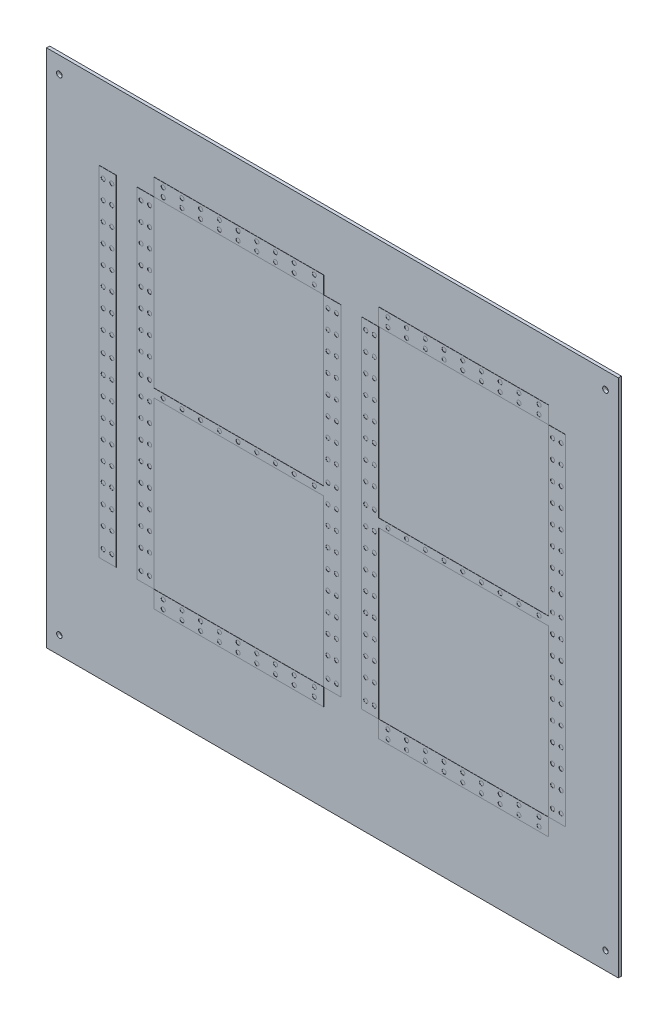
from build123d import *

# Parameters (mm, degrees)
ESBO_O4_W                      = 550
ESBO_O4_H                      = 500
FLANGE_BASE1_DEPTH             = 3
RESSALTO_EXTRUS_O1_OUTLINE_W   = 163.357552271
RESSALTO_EXTRUS_O1_OUTLINE_H   = 16.4
RESSALTO_EXTRUS_O1_OUTLINE_R   = 2
RESSALTO_EXTRUS_O1_OUTLINE_W_2 = 163.357552272
RESSALTO_EXTRUS_O1_OUTLINE_W_3 = 16.4
RESSALTO_EXTRUS_O1_OUTLINE_H_2 = 326.715104542
RESSALTO_EXTRUS_O1_DEPTH       = 0.2
ESBO_O5_R                      = 2.714887618
ESBO_O5_R_2                    = 2.6
CORTE_EXTRUS_O1_DEPTH          = 10


# Read off the part's stored shape, not the designer's step: Ressalto-extrusão1
# Sheet-metal steps are written as plain solids
with BuildPart() as part:
    # Esboço4 → Flange-base1 (new body)
    with BuildSketch(Plane.XY):
        Rectangle(ESBO_O4_W, ESBO_O4_H)
    extrude(amount=-FLANGE_BASE1_DEPTH)

    # Ressalto-extrusão1 outline → Ressalto-extrusão1 (add)
    # profile 1 of 7: a face of its own
    with BuildSketch(Plane.XY):
        with Locations((126.278776136, -157.578108444)):
            Rectangle(RESSALTO_EXTRUS_O1_OUTLINE_W, RESSALTO_EXTRUS_O1_OUTLINE_H)
        with Locations((53.6, -161.678108444)):
            Circle(RESSALTO_EXTRUS_O1_OUTLINE_R, mode=Mode.SUBTRACT)
        with Locations((53.6, -153.478108444)):
            Circle(RESSALTO_EXTRUS_O1_OUTLINE_R, mode=Mode.SUBTRACT)
        with Locations((71.6, -161.678108444)):
            Circle(RESSALTO_EXTRUS_O1_OUTLINE_R, mode=Mode.SUBTRACT)
        with Locations((71.6, -153.478108444)):
            Circle(RESSALTO_EXTRUS_O1_OUTLINE_R, mode=Mode.SUBTRACT)
        with Locations((89.6, -161.678108444)):
            Circle(RESSALTO_EXTRUS_O1_OUTLINE_R, mode=Mode.SUBTRACT)
        with Locations((107.6, -161.678108444)):
            Circle(RESSALTO_EXTRUS_O1_OUTLINE_R, mode=Mode.SUBTRACT)
        with Locations((89.6, -153.478108444)):
            Circle(RESSALTO_EXTRUS_O1_OUTLINE_R, mode=Mode.SUBTRACT)
        with Locations((107.6, -153.478108444)):
            Circle(RESSALTO_EXTRUS_O1_OUTLINE_R, mode=Mode.SUBTRACT)
        with Locations((125.6, -161.678108444)):
            Circle(RESSALTO_EXTRUS_O1_OUTLINE_R, mode=Mode.SUBTRACT)
        with Locations((125.6, -153.478108444)):
            Circle(RESSALTO_EXTRUS_O1_OUTLINE_R, mode=Mode.SUBTRACT)
        with Locations((143.6, -161.678108444)):
            Circle(RESSALTO_EXTRUS_O1_OUTLINE_R, mode=Mode.SUBTRACT)
        with Locations((161.6, -161.678108444)):
            Circle(RESSALTO_EXTRUS_O1_OUTLINE_R, mode=Mode.SUBTRACT)
        with Locations((143.6, -153.478108444)):
            Circle(RESSALTO_EXTRUS_O1_OUTLINE_R, mode=Mode.SUBTRACT)
        with Locations((161.6, -153.478108444)):
            Circle(RESSALTO_EXTRUS_O1_OUTLINE_R, mode=Mode.SUBTRACT)
        with Locations((179.6, -161.678108444)):
            Circle(RESSALTO_EXTRUS_O1_OUTLINE_R, mode=Mode.SUBTRACT)
        with Locations((179.6, -153.478108444)):
            Circle(RESSALTO_EXTRUS_O1_OUTLINE_R, mode=Mode.SUBTRACT)
        with Locations((198.957552271, -161.678108444)):
            Circle(RESSALTO_EXTRUS_O1_OUTLINE_R, mode=Mode.SUBTRACT)
        with Locations((198.957552271, -153.478108444)):
            Circle(RESSALTO_EXTRUS_O1_OUTLINE_R, mode=Mode.SUBTRACT)
    # profile 2 of 7: a face of its own
    with BuildSketch(Plane.XY):
        Polygon((207.957552271, 18.2), (44.6, 18.2), (44.6, 177.457552271), (28.2, 177.457552271), (28.2, -149.257552271), (44.6, -149.257552271), (44.6, 10), (207.957552271, 10), (207.957552271, -149.257552271), (224.357552271, -149.257552271), (224.357552271, 177.457552271), (207.957552271, 177.457552271), align=None)
        with Locations((32.3, -140.257552271)):
            Circle(RESSALTO_EXTRUS_O1_OUTLINE_R, mode=Mode.SUBTRACT)
        with Locations((40.5, -140.257552271)):
            Circle(RESSALTO_EXTRUS_O1_OUTLINE_R, mode=Mode.SUBTRACT)
        with Locations((32.3, -120.9)):
            Circle(RESSALTO_EXTRUS_O1_OUTLINE_R, mode=Mode.SUBTRACT)
        with Locations((40.5, -120.9)):
            Circle(RESSALTO_EXTRUS_O1_OUTLINE_R, mode=Mode.SUBTRACT)
        with Locations((32.3, -102.9)):
            Circle(RESSALTO_EXTRUS_O1_OUTLINE_R, mode=Mode.SUBTRACT)
        with Locations((40.5, -102.9)):
            Circle(RESSALTO_EXTRUS_O1_OUTLINE_R, mode=Mode.SUBTRACT)
        with Locations((32.3, -84.9)):
            Circle(RESSALTO_EXTRUS_O1_OUTLINE_R, mode=Mode.SUBTRACT)
        with Locations((40.5, -84.9)):
            Circle(RESSALTO_EXTRUS_O1_OUTLINE_R, mode=Mode.SUBTRACT)
        with Locations((212.057552271, -140.257552271)):
            Circle(RESSALTO_EXTRUS_O1_OUTLINE_R, mode=Mode.SUBTRACT)
        with Locations((220.257552271, -140.257552271)):
            Circle(RESSALTO_EXTRUS_O1_OUTLINE_R, mode=Mode.SUBTRACT)
        with Locations((212.057552271, -120.9)):
            Circle(RESSALTO_EXTRUS_O1_OUTLINE_R, mode=Mode.SUBTRACT)
        with Locations((220.257552271, -120.9)):
            Circle(RESSALTO_EXTRUS_O1_OUTLINE_R, mode=Mode.SUBTRACT)
        with Locations((212.057552271, -102.9)):
            Circle(RESSALTO_EXTRUS_O1_OUTLINE_R, mode=Mode.SUBTRACT)
        with Locations((220.257552271, -102.9)):
            Circle(RESSALTO_EXTRUS_O1_OUTLINE_R, mode=Mode.SUBTRACT)
        with Locations((212.057552271, -84.9)):
            Circle(RESSALTO_EXTRUS_O1_OUTLINE_R, mode=Mode.SUBTRACT)
        with Locations((220.257552271, -84.9)):
            Circle(RESSALTO_EXTRUS_O1_OUTLINE_R, mode=Mode.SUBTRACT)
        with Locations((32.3, -66.9)):
            Circle(RESSALTO_EXTRUS_O1_OUTLINE_R, mode=Mode.SUBTRACT)
        with Locations((40.5, -66.9)):
            Circle(RESSALTO_EXTRUS_O1_OUTLINE_R, mode=Mode.SUBTRACT)
        with Locations((32.3, -48.9)):
            Circle(RESSALTO_EXTRUS_O1_OUTLINE_R, mode=Mode.SUBTRACT)
        with Locations((40.5, -48.9)):
            Circle(RESSALTO_EXTRUS_O1_OUTLINE_R, mode=Mode.SUBTRACT)
        with Locations((32.3, -30.9)):
            Circle(RESSALTO_EXTRUS_O1_OUTLINE_R, mode=Mode.SUBTRACT)
        with Locations((40.5, -30.9)):
            Circle(RESSALTO_EXTRUS_O1_OUTLINE_R, mode=Mode.SUBTRACT)
        with Locations((32.3, -12.9)):
            Circle(RESSALTO_EXTRUS_O1_OUTLINE_R, mode=Mode.SUBTRACT)
        with Locations((40.5, -12.9)):
            Circle(RESSALTO_EXTRUS_O1_OUTLINE_R, mode=Mode.SUBTRACT)
        with Locations((32.3, 5.1)):
            Circle(RESSALTO_EXTRUS_O1_OUTLINE_R, mode=Mode.SUBTRACT)
        with Locations((40.5, 5.1)):
            Circle(RESSALTO_EXTRUS_O1_OUTLINE_R, mode=Mode.SUBTRACT)
        with Locations((53.6, 14.1)):
            Circle(RESSALTO_EXTRUS_O1_OUTLINE_R, mode=Mode.SUBTRACT)
        with Locations((71.6, 14.1)):
            Circle(RESSALTO_EXTRUS_O1_OUTLINE_R, mode=Mode.SUBTRACT)
        with Locations((89.6, 14.1)):
            Circle(RESSALTO_EXTRUS_O1_OUTLINE_R, mode=Mode.SUBTRACT)
        with Locations((107.6, 14.1)):
            Circle(RESSALTO_EXTRUS_O1_OUTLINE_R, mode=Mode.SUBTRACT)
        with Locations((212.057552271, -66.9)):
            Circle(RESSALTO_EXTRUS_O1_OUTLINE_R, mode=Mode.SUBTRACT)
        with Locations((220.257552271, -66.9)):
            Circle(RESSALTO_EXTRUS_O1_OUTLINE_R, mode=Mode.SUBTRACT)
        with Locations((212.057552271, -48.9)):
            Circle(RESSALTO_EXTRUS_O1_OUTLINE_R, mode=Mode.SUBTRACT)
        with Locations((220.257552271, -48.9)):
            Circle(RESSALTO_EXTRUS_O1_OUTLINE_R, mode=Mode.SUBTRACT)
        with Locations((212.057552271, -30.9)):
            Circle(RESSALTO_EXTRUS_O1_OUTLINE_R, mode=Mode.SUBTRACT)
        with Locations((220.257552271, -30.9)):
            Circle(RESSALTO_EXTRUS_O1_OUTLINE_R, mode=Mode.SUBTRACT)
        with Locations((125.6, 14.1)):
            Circle(RESSALTO_EXTRUS_O1_OUTLINE_R, mode=Mode.SUBTRACT)
        with Locations((143.6, 14.1)):
            Circle(RESSALTO_EXTRUS_O1_OUTLINE_R, mode=Mode.SUBTRACT)
        with Locations((161.6, 14.1)):
            Circle(RESSALTO_EXTRUS_O1_OUTLINE_R, mode=Mode.SUBTRACT)
        with Locations((212.057552271, -12.9)):
            Circle(RESSALTO_EXTRUS_O1_OUTLINE_R, mode=Mode.SUBTRACT)
        with Locations((220.257552271, -12.9)):
            Circle(RESSALTO_EXTRUS_O1_OUTLINE_R, mode=Mode.SUBTRACT)
        with Locations((179.6, 14.1)):
            Circle(RESSALTO_EXTRUS_O1_OUTLINE_R, mode=Mode.SUBTRACT)
        with Locations((198.957552271, 14.1)):
            Circle(RESSALTO_EXTRUS_O1_OUTLINE_R, mode=Mode.SUBTRACT)
        with Locations((212.057552271, 5.1)):
            Circle(RESSALTO_EXTRUS_O1_OUTLINE_R, mode=Mode.SUBTRACT)
        with Locations((220.257552271, 5.1)):
            Circle(RESSALTO_EXTRUS_O1_OUTLINE_R, mode=Mode.SUBTRACT)
        with Locations((32.3, 23.1)):
            Circle(RESSALTO_EXTRUS_O1_OUTLINE_R, mode=Mode.SUBTRACT)
        with Locations((40.5, 23.1)):
            Circle(RESSALTO_EXTRUS_O1_OUTLINE_R, mode=Mode.SUBTRACT)
        with Locations((32.3, 42.457552271)):
            Circle(RESSALTO_EXTRUS_O1_OUTLINE_R, mode=Mode.SUBTRACT)
        with Locations((40.5, 42.457552271)):
            Circle(RESSALTO_EXTRUS_O1_OUTLINE_R, mode=Mode.SUBTRACT)
        with Locations((32.3, 60.457552271)):
            Circle(RESSALTO_EXTRUS_O1_OUTLINE_R, mode=Mode.SUBTRACT)
        with Locations((40.5, 60.457552271)):
            Circle(RESSALTO_EXTRUS_O1_OUTLINE_R, mode=Mode.SUBTRACT)
        with Locations((32.3, 78.457552271)):
            Circle(RESSALTO_EXTRUS_O1_OUTLINE_R, mode=Mode.SUBTRACT)
        with Locations((40.5, 78.457552271)):
            Circle(RESSALTO_EXTRUS_O1_OUTLINE_R, mode=Mode.SUBTRACT)
        with Locations((32.3, 96.457552271)):
            Circle(RESSALTO_EXTRUS_O1_OUTLINE_R, mode=Mode.SUBTRACT)
        with Locations((40.5, 96.457552271)):
            Circle(RESSALTO_EXTRUS_O1_OUTLINE_R, mode=Mode.SUBTRACT)
        with Locations((212.057552271, 23.1)):
            Circle(RESSALTO_EXTRUS_O1_OUTLINE_R, mode=Mode.SUBTRACT)
        with Locations((220.257552271, 23.1)):
            Circle(RESSALTO_EXTRUS_O1_OUTLINE_R, mode=Mode.SUBTRACT)
        with Locations((212.057552271, 42.457552271)):
            Circle(RESSALTO_EXTRUS_O1_OUTLINE_R, mode=Mode.SUBTRACT)
        with Locations((220.257552271, 42.457552271)):
            Circle(RESSALTO_EXTRUS_O1_OUTLINE_R, mode=Mode.SUBTRACT)
        with Locations((212.057552271, 60.457552271)):
            Circle(RESSALTO_EXTRUS_O1_OUTLINE_R, mode=Mode.SUBTRACT)
        with Locations((220.257552271, 60.457552271)):
            Circle(RESSALTO_EXTRUS_O1_OUTLINE_R, mode=Mode.SUBTRACT)
        with Locations((212.057552271, 78.457552271)):
            Circle(RESSALTO_EXTRUS_O1_OUTLINE_R, mode=Mode.SUBTRACT)
        with Locations((220.257552271, 78.457552271)):
            Circle(RESSALTO_EXTRUS_O1_OUTLINE_R, mode=Mode.SUBTRACT)
        with Locations((212.057552271, 96.457552271)):
            Circle(RESSALTO_EXTRUS_O1_OUTLINE_R, mode=Mode.SUBTRACT)
        with Locations((220.257552271, 96.457552271)):
            Circle(RESSALTO_EXTRUS_O1_OUTLINE_R, mode=Mode.SUBTRACT)
        with Locations((32.3, 114.457552271)):
            Circle(RESSALTO_EXTRUS_O1_OUTLINE_R, mode=Mode.SUBTRACT)
        with Locations((40.5, 114.457552271)):
            Circle(RESSALTO_EXTRUS_O1_OUTLINE_R, mode=Mode.SUBTRACT)
        with Locations((32.3, 132.457552271)):
            Circle(RESSALTO_EXTRUS_O1_OUTLINE_R, mode=Mode.SUBTRACT)
        with Locations((40.5, 132.457552271)):
            Circle(RESSALTO_EXTRUS_O1_OUTLINE_R, mode=Mode.SUBTRACT)
        with Locations((32.3, 150.457552271)):
            Circle(RESSALTO_EXTRUS_O1_OUTLINE_R, mode=Mode.SUBTRACT)
        with Locations((40.5, 150.457552271)):
            Circle(RESSALTO_EXTRUS_O1_OUTLINE_R, mode=Mode.SUBTRACT)
        with Locations((32.3, 168.457552271)):
            Circle(RESSALTO_EXTRUS_O1_OUTLINE_R, mode=Mode.SUBTRACT)
        with Locations((40.5, 168.457552271)):
            Circle(RESSALTO_EXTRUS_O1_OUTLINE_R, mode=Mode.SUBTRACT)
        with Locations((212.057552271, 114.457552271)):
            Circle(RESSALTO_EXTRUS_O1_OUTLINE_R, mode=Mode.SUBTRACT)
        with Locations((220.257552271, 114.457552271)):
            Circle(RESSALTO_EXTRUS_O1_OUTLINE_R, mode=Mode.SUBTRACT)
        with Locations((212.057552271, 132.457552271)):
            Circle(RESSALTO_EXTRUS_O1_OUTLINE_R, mode=Mode.SUBTRACT)
        with Locations((220.257552271, 132.457552271)):
            Circle(RESSALTO_EXTRUS_O1_OUTLINE_R, mode=Mode.SUBTRACT)
        with Locations((212.057552271, 150.457552271)):
            Circle(RESSALTO_EXTRUS_O1_OUTLINE_R, mode=Mode.SUBTRACT)
        with Locations((220.257552271, 150.457552271)):
            Circle(RESSALTO_EXTRUS_O1_OUTLINE_R, mode=Mode.SUBTRACT)
        with Locations((212.057552271, 168.457552271)):
            Circle(RESSALTO_EXTRUS_O1_OUTLINE_R, mode=Mode.SUBTRACT)
        with Locations((220.257552271, 168.457552271)):
            Circle(RESSALTO_EXTRUS_O1_OUTLINE_R, mode=Mode.SUBTRACT)
    # profile 3 of 7: a face of its own
    with BuildSketch(Plane.XY):
        with Locations((126.272234862, 185.790227079)):
            Rectangle(RESSALTO_EXTRUS_O1_OUTLINE_W_2, RESSALTO_EXTRUS_O1_OUTLINE_H)
        with Locations((53.593458726, 181.690227079)):
            Circle(RESSALTO_EXTRUS_O1_OUTLINE_R, mode=Mode.SUBTRACT)
        with Locations((53.593458726, 189.890227079)):
            Circle(RESSALTO_EXTRUS_O1_OUTLINE_R, mode=Mode.SUBTRACT)
        with Locations((71.593458726, 181.690227079)):
            Circle(RESSALTO_EXTRUS_O1_OUTLINE_R, mode=Mode.SUBTRACT)
        with Locations((71.593458726, 189.890227079)):
            Circle(RESSALTO_EXTRUS_O1_OUTLINE_R, mode=Mode.SUBTRACT)
        with Locations((89.593458726, 181.690227079)):
            Circle(RESSALTO_EXTRUS_O1_OUTLINE_R, mode=Mode.SUBTRACT)
        with Locations((107.593458726, 181.690227079)):
            Circle(RESSALTO_EXTRUS_O1_OUTLINE_R, mode=Mode.SUBTRACT)
        with Locations((89.593458726, 189.890227079)):
            Circle(RESSALTO_EXTRUS_O1_OUTLINE_R, mode=Mode.SUBTRACT)
        with Locations((107.593458726, 189.890227079)):
            Circle(RESSALTO_EXTRUS_O1_OUTLINE_R, mode=Mode.SUBTRACT)
        with Locations((125.593458726, 181.690227079)):
            Circle(RESSALTO_EXTRUS_O1_OUTLINE_R, mode=Mode.SUBTRACT)
        with Locations((125.593458726, 189.890227079)):
            Circle(RESSALTO_EXTRUS_O1_OUTLINE_R, mode=Mode.SUBTRACT)
        with Locations((143.593458726, 181.690227079)):
            Circle(RESSALTO_EXTRUS_O1_OUTLINE_R, mode=Mode.SUBTRACT)
        with Locations((161.593458726, 181.690227079)):
            Circle(RESSALTO_EXTRUS_O1_OUTLINE_R, mode=Mode.SUBTRACT)
        with Locations((143.593458726, 189.890227079)):
            Circle(RESSALTO_EXTRUS_O1_OUTLINE_R, mode=Mode.SUBTRACT)
        with Locations((161.593458726, 189.890227079)):
            Circle(RESSALTO_EXTRUS_O1_OUTLINE_R, mode=Mode.SUBTRACT)
        with Locations((179.593458726, 181.690227079)):
            Circle(RESSALTO_EXTRUS_O1_OUTLINE_R, mode=Mode.SUBTRACT)
        with Locations((179.593458726, 189.890227079)):
            Circle(RESSALTO_EXTRUS_O1_OUTLINE_R, mode=Mode.SUBTRACT)
        with Locations((198.951010998, 181.690227079)):
            Circle(RESSALTO_EXTRUS_O1_OUTLINE_R, mode=Mode.SUBTRACT)
        with Locations((198.951010998, 189.890227079)):
            Circle(RESSALTO_EXTRUS_O1_OUTLINE_R, mode=Mode.SUBTRACT)
    # profile 4 of 7: a face of its own
    with BuildSketch(Plane.XY):
        with Locations((-89.878776136, -157.457552271)):
            Rectangle(RESSALTO_EXTRUS_O1_OUTLINE_W, RESSALTO_EXTRUS_O1_OUTLINE_H)
        with Locations((-162.557552271, -161.557552271)):
            Circle(RESSALTO_EXTRUS_O1_OUTLINE_R, mode=Mode.SUBTRACT)
        with Locations((-144.557552271, -161.557552271)):
            Circle(RESSALTO_EXTRUS_O1_OUTLINE_R, mode=Mode.SUBTRACT)
        with Locations((-162.557552271, -153.357552271)):
            Circle(RESSALTO_EXTRUS_O1_OUTLINE_R, mode=Mode.SUBTRACT)
        with Locations((-144.557552271, -153.357552271)):
            Circle(RESSALTO_EXTRUS_O1_OUTLINE_R, mode=Mode.SUBTRACT)
        with Locations((-126.557552271, -161.557552271)):
            Circle(RESSALTO_EXTRUS_O1_OUTLINE_R, mode=Mode.SUBTRACT)
        with Locations((-126.557552271, -153.357552271)):
            Circle(RESSALTO_EXTRUS_O1_OUTLINE_R, mode=Mode.SUBTRACT)
        with Locations((-108.557552271, -161.557552271)):
            Circle(RESSALTO_EXTRUS_O1_OUTLINE_R, mode=Mode.SUBTRACT)
        with Locations((-90.557552271, -161.557552271)):
            Circle(RESSALTO_EXTRUS_O1_OUTLINE_R, mode=Mode.SUBTRACT)
        with Locations((-108.557552271, -153.357552271)):
            Circle(RESSALTO_EXTRUS_O1_OUTLINE_R, mode=Mode.SUBTRACT)
        with Locations((-90.557552271, -153.357552271)):
            Circle(RESSALTO_EXTRUS_O1_OUTLINE_R, mode=Mode.SUBTRACT)
        with Locations((-72.557552271, -161.557552271)):
            Circle(RESSALTO_EXTRUS_O1_OUTLINE_R, mode=Mode.SUBTRACT)
        with Locations((-72.557552271, -153.357552271)):
            Circle(RESSALTO_EXTRUS_O1_OUTLINE_R, mode=Mode.SUBTRACT)
        with Locations((-54.557552271, -161.557552271)):
            Circle(RESSALTO_EXTRUS_O1_OUTLINE_R, mode=Mode.SUBTRACT)
        with Locations((-36.557552271, -161.557552271)):
            Circle(RESSALTO_EXTRUS_O1_OUTLINE_R, mode=Mode.SUBTRACT)
        with Locations((-54.557552271, -153.357552271)):
            Circle(RESSALTO_EXTRUS_O1_OUTLINE_R, mode=Mode.SUBTRACT)
        with Locations((-36.557552271, -153.357552271)):
            Circle(RESSALTO_EXTRUS_O1_OUTLINE_R, mode=Mode.SUBTRACT)
        with Locations((-17.2, -161.557552271)):
            Circle(RESSALTO_EXTRUS_O1_OUTLINE_R, mode=Mode.SUBTRACT)
        with Locations((-17.2, -153.357552271)):
            Circle(RESSALTO_EXTRUS_O1_OUTLINE_R, mode=Mode.SUBTRACT)
    # profile 5 of 7: a face of its own
    with BuildSketch(Plane.XY):
        Polygon((-8.2, 18.320556173), (-171.557552271, 18.320556173), (-171.557552271, 177.578108444), (-187.957552271, 177.578108444), (-187.957552271, -149.136996099), (-171.557552271, -149.136996099), (-171.557552271, 10.120556173), (-8.2, 10.120556173), (-8.2, -149.136996099), (8.2, -149.136996099), (8.2, 177.578108444), (-8.2, 177.578108444), align=None)
        with Locations((-183.857552271, -140.136996099)):
            Circle(RESSALTO_EXTRUS_O1_OUTLINE_R, mode=Mode.SUBTRACT)
        with Locations((-175.657552271, -140.136996099)):
            Circle(RESSALTO_EXTRUS_O1_OUTLINE_R, mode=Mode.SUBTRACT)
        with Locations((-183.857552271, -120.779443827)):
            Circle(RESSALTO_EXTRUS_O1_OUTLINE_R, mode=Mode.SUBTRACT)
        with Locations((-175.657552271, -120.779443827)):
            Circle(RESSALTO_EXTRUS_O1_OUTLINE_R, mode=Mode.SUBTRACT)
        with Locations((-183.857552271, -102.779443827)):
            Circle(RESSALTO_EXTRUS_O1_OUTLINE_R, mode=Mode.SUBTRACT)
        with Locations((-175.657552271, -102.779443827)):
            Circle(RESSALTO_EXTRUS_O1_OUTLINE_R, mode=Mode.SUBTRACT)
        with Locations((-183.857552271, -84.779443827)):
            Circle(RESSALTO_EXTRUS_O1_OUTLINE_R, mode=Mode.SUBTRACT)
        with Locations((-175.657552271, -84.779443827)):
            Circle(RESSALTO_EXTRUS_O1_OUTLINE_R, mode=Mode.SUBTRACT)
        with Locations((-4.1, -140.136996099)):
            Circle(RESSALTO_EXTRUS_O1_OUTLINE_R, mode=Mode.SUBTRACT)
        with Locations((-4.1, -120.779443827)):
            Circle(RESSALTO_EXTRUS_O1_OUTLINE_R, mode=Mode.SUBTRACT)
        with Locations((-4.1, -102.779443827)):
            Circle(RESSALTO_EXTRUS_O1_OUTLINE_R, mode=Mode.SUBTRACT)
        with Locations((-4.1, -84.779443827)):
            Circle(RESSALTO_EXTRUS_O1_OUTLINE_R, mode=Mode.SUBTRACT)
        with Locations((-183.857552271, -66.779443827)):
            Circle(RESSALTO_EXTRUS_O1_OUTLINE_R, mode=Mode.SUBTRACT)
        with Locations((-175.657552271, -66.779443827)):
            Circle(RESSALTO_EXTRUS_O1_OUTLINE_R, mode=Mode.SUBTRACT)
        with Locations((-183.857552271, -48.779443827)):
            Circle(RESSALTO_EXTRUS_O1_OUTLINE_R, mode=Mode.SUBTRACT)
        with Locations((-175.657552271, -48.779443827)):
            Circle(RESSALTO_EXTRUS_O1_OUTLINE_R, mode=Mode.SUBTRACT)
        with Locations((-183.857552271, -30.779443827)):
            Circle(RESSALTO_EXTRUS_O1_OUTLINE_R, mode=Mode.SUBTRACT)
        with Locations((-175.657552271, -30.779443827)):
            Circle(RESSALTO_EXTRUS_O1_OUTLINE_R, mode=Mode.SUBTRACT)
        with Locations((-183.857552271, -12.779443827)):
            Circle(RESSALTO_EXTRUS_O1_OUTLINE_R, mode=Mode.SUBTRACT)
        with Locations((-175.657552271, -12.779443827)):
            Circle(RESSALTO_EXTRUS_O1_OUTLINE_R, mode=Mode.SUBTRACT)
        with Locations((-183.857552271, 5.220556173)):
            Circle(RESSALTO_EXTRUS_O1_OUTLINE_R, mode=Mode.SUBTRACT)
        with Locations((-175.657552271, 5.220556173)):
            Circle(RESSALTO_EXTRUS_O1_OUTLINE_R, mode=Mode.SUBTRACT)
        with Locations((-4.1, -66.779443827)):
            Circle(RESSALTO_EXTRUS_O1_OUTLINE_R, mode=Mode.SUBTRACT)
        with Locations((-4.1, -48.779443827)):
            Circle(RESSALTO_EXTRUS_O1_OUTLINE_R, mode=Mode.SUBTRACT)
        with Locations((-4.1, -30.779443827)):
            Circle(RESSALTO_EXTRUS_O1_OUTLINE_R, mode=Mode.SUBTRACT)
        with Locations((-4.1, -12.779443827)):
            Circle(RESSALTO_EXTRUS_O1_OUTLINE_R, mode=Mode.SUBTRACT)
        with Locations((-4.1, 5.220556173)):
            Circle(RESSALTO_EXTRUS_O1_OUTLINE_R, mode=Mode.SUBTRACT)
        with Locations((4.1, -140.136996099)):
            Circle(RESSALTO_EXTRUS_O1_OUTLINE_R, mode=Mode.SUBTRACT)
        with Locations((4.1, -120.779443827)):
            Circle(RESSALTO_EXTRUS_O1_OUTLINE_R, mode=Mode.SUBTRACT)
        with Locations((4.1, -102.779443827)):
            Circle(RESSALTO_EXTRUS_O1_OUTLINE_R, mode=Mode.SUBTRACT)
        with Locations((4.1, -84.779443827)):
            Circle(RESSALTO_EXTRUS_O1_OUTLINE_R, mode=Mode.SUBTRACT)
        with Locations((4.1, -66.779443827)):
            Circle(RESSALTO_EXTRUS_O1_OUTLINE_R, mode=Mode.SUBTRACT)
        with Locations((4.1, -48.779443827)):
            Circle(RESSALTO_EXTRUS_O1_OUTLINE_R, mode=Mode.SUBTRACT)
        with Locations((4.1, -30.779443827)):
            Circle(RESSALTO_EXTRUS_O1_OUTLINE_R, mode=Mode.SUBTRACT)
        with Locations((4.1, -12.779443827)):
            Circle(RESSALTO_EXTRUS_O1_OUTLINE_R, mode=Mode.SUBTRACT)
        with Locations((4.1, 5.220556173)):
            Circle(RESSALTO_EXTRUS_O1_OUTLINE_R, mode=Mode.SUBTRACT)
        with Locations((-183.857552271, 23.220556173)):
            Circle(RESSALTO_EXTRUS_O1_OUTLINE_R, mode=Mode.SUBTRACT)
        with Locations((-175.657552271, 23.220556173)):
            Circle(RESSALTO_EXTRUS_O1_OUTLINE_R, mode=Mode.SUBTRACT)
        with Locations((-183.857552271, 42.578108444)):
            Circle(RESSALTO_EXTRUS_O1_OUTLINE_R, mode=Mode.SUBTRACT)
        with Locations((-175.657552271, 42.578108444)):
            Circle(RESSALTO_EXTRUS_O1_OUTLINE_R, mode=Mode.SUBTRACT)
        with Locations((-162.557552271, 14.220556173)):
            Circle(RESSALTO_EXTRUS_O1_OUTLINE_R, mode=Mode.SUBTRACT)
        with Locations((-144.557552271, 14.220556173)):
            Circle(RESSALTO_EXTRUS_O1_OUTLINE_R, mode=Mode.SUBTRACT)
        with Locations((-126.557552271, 14.220556173)):
            Circle(RESSALTO_EXTRUS_O1_OUTLINE_R, mode=Mode.SUBTRACT)
        with Locations((-183.857552271, 60.578108444)):
            Circle(RESSALTO_EXTRUS_O1_OUTLINE_R, mode=Mode.SUBTRACT)
        with Locations((-175.657552271, 60.578108444)):
            Circle(RESSALTO_EXTRUS_O1_OUTLINE_R, mode=Mode.SUBTRACT)
        with Locations((-183.857552271, 78.578108444)):
            Circle(RESSALTO_EXTRUS_O1_OUTLINE_R, mode=Mode.SUBTRACT)
        with Locations((-175.657552271, 78.578108444)):
            Circle(RESSALTO_EXTRUS_O1_OUTLINE_R, mode=Mode.SUBTRACT)
        with Locations((-183.857552271, 96.578108444)):
            Circle(RESSALTO_EXTRUS_O1_OUTLINE_R, mode=Mode.SUBTRACT)
        with Locations((-175.657552271, 96.578108444)):
            Circle(RESSALTO_EXTRUS_O1_OUTLINE_R, mode=Mode.SUBTRACT)
        with Locations((-108.557552271, 14.220556173)):
            Circle(RESSALTO_EXTRUS_O1_OUTLINE_R, mode=Mode.SUBTRACT)
        with Locations((-90.557552271, 14.220556173)):
            Circle(RESSALTO_EXTRUS_O1_OUTLINE_R, mode=Mode.SUBTRACT)
        with Locations((-72.557552271, 14.220556173)):
            Circle(RESSALTO_EXTRUS_O1_OUTLINE_R, mode=Mode.SUBTRACT)
        with Locations((-54.557552271, 14.220556173)):
            Circle(RESSALTO_EXTRUS_O1_OUTLINE_R, mode=Mode.SUBTRACT)
        with Locations((-36.557552271, 14.220556173)):
            Circle(RESSALTO_EXTRUS_O1_OUTLINE_R, mode=Mode.SUBTRACT)
        with Locations((-17.2, 14.220556173)):
            Circle(RESSALTO_EXTRUS_O1_OUTLINE_R, mode=Mode.SUBTRACT)
        with Locations((-4.1, 23.220556173)):
            Circle(RESSALTO_EXTRUS_O1_OUTLINE_R, mode=Mode.SUBTRACT)
        with Locations((-4.1, 42.578108444)):
            Circle(RESSALTO_EXTRUS_O1_OUTLINE_R, mode=Mode.SUBTRACT)
        with Locations((-4.1, 60.578108444)):
            Circle(RESSALTO_EXTRUS_O1_OUTLINE_R, mode=Mode.SUBTRACT)
        with Locations((-4.1, 78.578108444)):
            Circle(RESSALTO_EXTRUS_O1_OUTLINE_R, mode=Mode.SUBTRACT)
        with Locations((-4.1, 96.578108444)):
            Circle(RESSALTO_EXTRUS_O1_OUTLINE_R, mode=Mode.SUBTRACT)
        with Locations((-183.857552271, 114.578108444)):
            Circle(RESSALTO_EXTRUS_O1_OUTLINE_R, mode=Mode.SUBTRACT)
        with Locations((-175.657552271, 114.578108444)):
            Circle(RESSALTO_EXTRUS_O1_OUTLINE_R, mode=Mode.SUBTRACT)
        with Locations((-183.857552271, 132.578108444)):
            Circle(RESSALTO_EXTRUS_O1_OUTLINE_R, mode=Mode.SUBTRACT)
        with Locations((-175.657552271, 132.578108444)):
            Circle(RESSALTO_EXTRUS_O1_OUTLINE_R, mode=Mode.SUBTRACT)
        with Locations((-183.857552271, 150.578108444)):
            Circle(RESSALTO_EXTRUS_O1_OUTLINE_R, mode=Mode.SUBTRACT)
        with Locations((-175.657552271, 150.578108444)):
            Circle(RESSALTO_EXTRUS_O1_OUTLINE_R, mode=Mode.SUBTRACT)
        with Locations((-183.857552271, 168.578108444)):
            Circle(RESSALTO_EXTRUS_O1_OUTLINE_R, mode=Mode.SUBTRACT)
        with Locations((-175.657552271, 168.578108444)):
            Circle(RESSALTO_EXTRUS_O1_OUTLINE_R, mode=Mode.SUBTRACT)
        with Locations((-4.1, 114.578108444)):
            Circle(RESSALTO_EXTRUS_O1_OUTLINE_R, mode=Mode.SUBTRACT)
        with Locations((-4.1, 132.578108444)):
            Circle(RESSALTO_EXTRUS_O1_OUTLINE_R, mode=Mode.SUBTRACT)
        with Locations((-4.1, 150.578108444)):
            Circle(RESSALTO_EXTRUS_O1_OUTLINE_R, mode=Mode.SUBTRACT)
        with Locations((-4.1, 168.578108444)):
            Circle(RESSALTO_EXTRUS_O1_OUTLINE_R, mode=Mode.SUBTRACT)
        with Locations((4.1, 23.220556173)):
            Circle(RESSALTO_EXTRUS_O1_OUTLINE_R, mode=Mode.SUBTRACT)
        with Locations((4.1, 42.578108444)):
            Circle(RESSALTO_EXTRUS_O1_OUTLINE_R, mode=Mode.SUBTRACT)
        with Locations((4.1, 60.578108444)):
            Circle(RESSALTO_EXTRUS_O1_OUTLINE_R, mode=Mode.SUBTRACT)
        with Locations((4.1, 78.578108444)):
            Circle(RESSALTO_EXTRUS_O1_OUTLINE_R, mode=Mode.SUBTRACT)
        with Locations((4.1, 96.578108444)):
            Circle(RESSALTO_EXTRUS_O1_OUTLINE_R, mode=Mode.SUBTRACT)
        with Locations((4.1, 114.578108444)):
            Circle(RESSALTO_EXTRUS_O1_OUTLINE_R, mode=Mode.SUBTRACT)
        with Locations((4.1, 132.578108444)):
            Circle(RESSALTO_EXTRUS_O1_OUTLINE_R, mode=Mode.SUBTRACT)
        with Locations((4.1, 150.578108444)):
            Circle(RESSALTO_EXTRUS_O1_OUTLINE_R, mode=Mode.SUBTRACT)
        with Locations((4.1, 168.578108444)):
            Circle(RESSALTO_EXTRUS_O1_OUTLINE_R, mode=Mode.SUBTRACT)
    # profile 6 of 7: a face of its own
    with BuildSketch(Plane.XY):
        with Locations((-89.88531741, 185.910783252)):
            Rectangle(RESSALTO_EXTRUS_O1_OUTLINE_W, RESSALTO_EXTRUS_O1_OUTLINE_H)
        with Locations((-162.564093545, 181.810783252)):
            Circle(RESSALTO_EXTRUS_O1_OUTLINE_R, mode=Mode.SUBTRACT)
        with Locations((-144.564093545, 181.810783252)):
            Circle(RESSALTO_EXTRUS_O1_OUTLINE_R, mode=Mode.SUBTRACT)
        with Locations((-162.564093545, 190.010783252)):
            Circle(RESSALTO_EXTRUS_O1_OUTLINE_R, mode=Mode.SUBTRACT)
        with Locations((-144.564093545, 190.010783252)):
            Circle(RESSALTO_EXTRUS_O1_OUTLINE_R, mode=Mode.SUBTRACT)
        with Locations((-126.564093545, 181.810783252)):
            Circle(RESSALTO_EXTRUS_O1_OUTLINE_R, mode=Mode.SUBTRACT)
        with Locations((-126.564093545, 190.010783252)):
            Circle(RESSALTO_EXTRUS_O1_OUTLINE_R, mode=Mode.SUBTRACT)
        with Locations((-108.564093545, 181.810783252)):
            Circle(RESSALTO_EXTRUS_O1_OUTLINE_R, mode=Mode.SUBTRACT)
        with Locations((-90.564093545, 181.810783252)):
            Circle(RESSALTO_EXTRUS_O1_OUTLINE_R, mode=Mode.SUBTRACT)
        with Locations((-108.564093545, 190.010783252)):
            Circle(RESSALTO_EXTRUS_O1_OUTLINE_R, mode=Mode.SUBTRACT)
        with Locations((-90.564093545, 190.010783252)):
            Circle(RESSALTO_EXTRUS_O1_OUTLINE_R, mode=Mode.SUBTRACT)
        with Locations((-72.564093545, 181.810783252)):
            Circle(RESSALTO_EXTRUS_O1_OUTLINE_R, mode=Mode.SUBTRACT)
        with Locations((-72.564093545, 190.010783252)):
            Circle(RESSALTO_EXTRUS_O1_OUTLINE_R, mode=Mode.SUBTRACT)
        with Locations((-54.564093545, 181.810783252)):
            Circle(RESSALTO_EXTRUS_O1_OUTLINE_R, mode=Mode.SUBTRACT)
        with Locations((-36.564093545, 181.810783252)):
            Circle(RESSALTO_EXTRUS_O1_OUTLINE_R, mode=Mode.SUBTRACT)
        with Locations((-54.564093545, 190.010783252)):
            Circle(RESSALTO_EXTRUS_O1_OUTLINE_R, mode=Mode.SUBTRACT)
        with Locations((-36.564093545, 190.010783252)):
            Circle(RESSALTO_EXTRUS_O1_OUTLINE_R, mode=Mode.SUBTRACT)
        with Locations((-17.206541274, 181.810783252)):
            Circle(RESSALTO_EXTRUS_O1_OUTLINE_R, mode=Mode.SUBTRACT)
        with Locations((-17.206541274, 190.010783252)):
            Circle(RESSALTO_EXTRUS_O1_OUTLINE_R, mode=Mode.SUBTRACT)
    # profile 7 of 7: a face of its own
    with BuildSketch(Plane.XY):
        with Locations((-216.157552271, 14.1)):
            Rectangle(RESSALTO_EXTRUS_O1_OUTLINE_W_3, RESSALTO_EXTRUS_O1_OUTLINE_H_2)
        with Locations((-220.257552271, -140.257552271)):
            Circle(RESSALTO_EXTRUS_O1_OUTLINE_R, mode=Mode.SUBTRACT)
        with Locations((-212.057552271, -140.257552271)):
            Circle(RESSALTO_EXTRUS_O1_OUTLINE_R, mode=Mode.SUBTRACT)
        with Locations((-220.257552271, -120.9)):
            Circle(RESSALTO_EXTRUS_O1_OUTLINE_R, mode=Mode.SUBTRACT)
        with Locations((-212.057552271, -120.9)):
            Circle(RESSALTO_EXTRUS_O1_OUTLINE_R, mode=Mode.SUBTRACT)
        with Locations((-220.257552271, -102.9)):
            Circle(RESSALTO_EXTRUS_O1_OUTLINE_R, mode=Mode.SUBTRACT)
        with Locations((-212.057552271, -102.9)):
            Circle(RESSALTO_EXTRUS_O1_OUTLINE_R, mode=Mode.SUBTRACT)
        with Locations((-220.257552271, -84.9)):
            Circle(RESSALTO_EXTRUS_O1_OUTLINE_R, mode=Mode.SUBTRACT)
        with Locations((-212.057552271, -84.9)):
            Circle(RESSALTO_EXTRUS_O1_OUTLINE_R, mode=Mode.SUBTRACT)
        with Locations((-220.257552271, -66.9)):
            Circle(RESSALTO_EXTRUS_O1_OUTLINE_R, mode=Mode.SUBTRACT)
        with Locations((-212.057552271, -66.9)):
            Circle(RESSALTO_EXTRUS_O1_OUTLINE_R, mode=Mode.SUBTRACT)
        with Locations((-220.257552271, -48.9)):
            Circle(RESSALTO_EXTRUS_O1_OUTLINE_R, mode=Mode.SUBTRACT)
        with Locations((-212.057552271, -48.9)):
            Circle(RESSALTO_EXTRUS_O1_OUTLINE_R, mode=Mode.SUBTRACT)
        with Locations((-220.257552271, -30.9)):
            Circle(RESSALTO_EXTRUS_O1_OUTLINE_R, mode=Mode.SUBTRACT)
        with Locations((-212.057552271, -30.9)):
            Circle(RESSALTO_EXTRUS_O1_OUTLINE_R, mode=Mode.SUBTRACT)
        with Locations((-220.257552271, -12.9)):
            Circle(RESSALTO_EXTRUS_O1_OUTLINE_R, mode=Mode.SUBTRACT)
        with Locations((-212.057552271, -12.9)):
            Circle(RESSALTO_EXTRUS_O1_OUTLINE_R, mode=Mode.SUBTRACT)
        with Locations((-220.257552271, 5.1)):
            Circle(RESSALTO_EXTRUS_O1_OUTLINE_R, mode=Mode.SUBTRACT)
        with Locations((-212.057552271, 5.1)):
            Circle(RESSALTO_EXTRUS_O1_OUTLINE_R, mode=Mode.SUBTRACT)
        with Locations((-220.257552271, 23.1)):
            Circle(RESSALTO_EXTRUS_O1_OUTLINE_R, mode=Mode.SUBTRACT)
        with Locations((-212.057552271, 23.1)):
            Circle(RESSALTO_EXTRUS_O1_OUTLINE_R, mode=Mode.SUBTRACT)
        with Locations((-220.257552271, 42.457552271)):
            Circle(RESSALTO_EXTRUS_O1_OUTLINE_R, mode=Mode.SUBTRACT)
        with Locations((-212.057552271, 42.457552271)):
            Circle(RESSALTO_EXTRUS_O1_OUTLINE_R, mode=Mode.SUBTRACT)
        with Locations((-220.257552271, 60.457552271)):
            Circle(RESSALTO_EXTRUS_O1_OUTLINE_R, mode=Mode.SUBTRACT)
        with Locations((-212.057552271, 60.457552271)):
            Circle(RESSALTO_EXTRUS_O1_OUTLINE_R, mode=Mode.SUBTRACT)
        with Locations((-220.257552271, 78.457552271)):
            Circle(RESSALTO_EXTRUS_O1_OUTLINE_R, mode=Mode.SUBTRACT)
        with Locations((-212.057552271, 78.457552271)):
            Circle(RESSALTO_EXTRUS_O1_OUTLINE_R, mode=Mode.SUBTRACT)
        with Locations((-220.257552271, 96.457552271)):
            Circle(RESSALTO_EXTRUS_O1_OUTLINE_R, mode=Mode.SUBTRACT)
        with Locations((-212.057552271, 96.457552271)):
            Circle(RESSALTO_EXTRUS_O1_OUTLINE_R, mode=Mode.SUBTRACT)
        with Locations((-220.257552271, 114.457552271)):
            Circle(RESSALTO_EXTRUS_O1_OUTLINE_R, mode=Mode.SUBTRACT)
        with Locations((-212.057552271, 114.457552271)):
            Circle(RESSALTO_EXTRUS_O1_OUTLINE_R, mode=Mode.SUBTRACT)
        with Locations((-220.257552271, 132.457552271)):
            Circle(RESSALTO_EXTRUS_O1_OUTLINE_R, mode=Mode.SUBTRACT)
        with Locations((-212.057552271, 132.457552271)):
            Circle(RESSALTO_EXTRUS_O1_OUTLINE_R, mode=Mode.SUBTRACT)
        with Locations((-220.257552271, 150.457552271)):
            Circle(RESSALTO_EXTRUS_O1_OUTLINE_R, mode=Mode.SUBTRACT)
        with Locations((-212.057552271, 150.457552271)):
            Circle(RESSALTO_EXTRUS_O1_OUTLINE_R, mode=Mode.SUBTRACT)
        with Locations((-220.257552271, 168.457552271)):
            Circle(RESSALTO_EXTRUS_O1_OUTLINE_R, mode=Mode.SUBTRACT)
        with Locations((-212.057552271, 168.457552271)):
            Circle(RESSALTO_EXTRUS_O1_OUTLINE_R, mode=Mode.SUBTRACT)
    extrude(amount=RESSALTO_EXTRUS_O1_DEPTH)

    # Esboço5 → Corte-extrusão1 (cut)
    with BuildSketch(Plane.XY):
        with Locations((262.706189469, 234.004308936)):
            Circle(ESBO_O5_R)
        with Locations((262.706189469, -233.093281996)):
            Circle(ESBO_O5_R_2)
        with Locations(Location((-262.706189469, -233.093281996, 0), (0, 0, 180))):
            Circle(ESBO_O5_R_2)
        with Locations(Location((-262.706189469, 234.004308936, 0), (0, 0, 180))):
            Circle(ESBO_O5_R)
        with Locations((33.081235093, 0)):
            Circle(ESBO_O5_R_2)
    extrude(amount=-CORTE_EXTRUS_O1_DEPTH, mode=Mode.SUBTRACT)


solid = part.part
